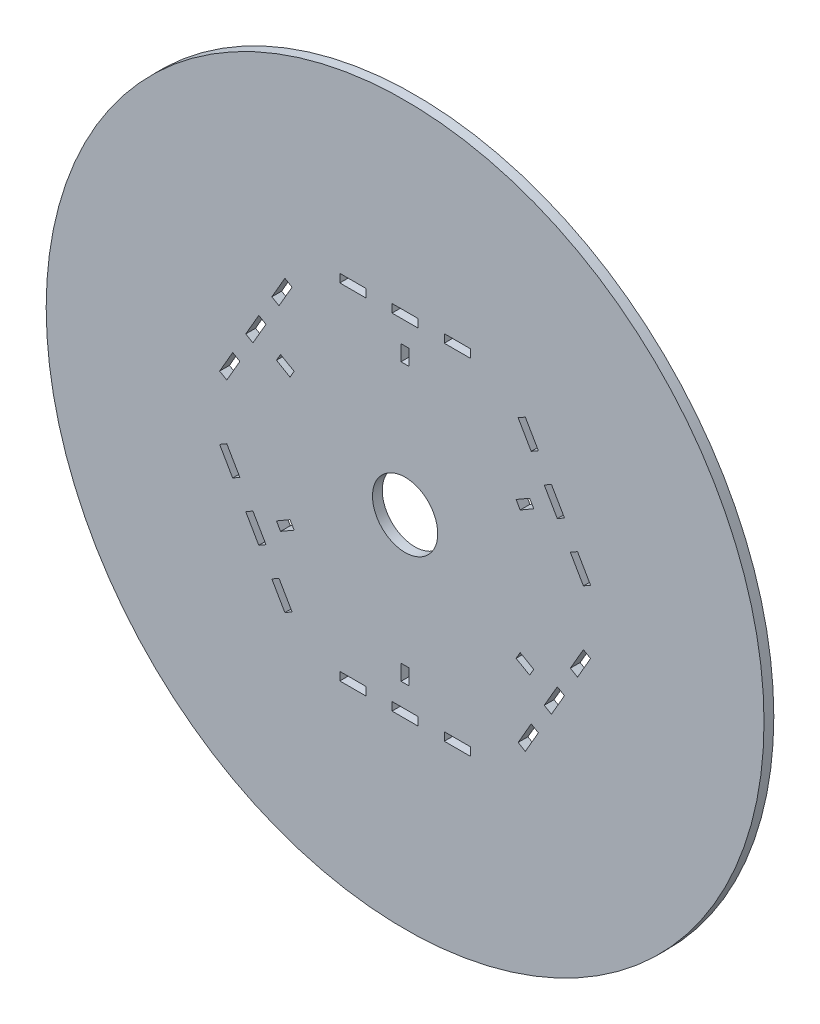
from build123d import *

# Parameters (mm, degrees)
SKETCH1_R           = 137.5
SKETCH1_R_2         = 12.5
SKETCH1_W           = 10
SKETCH1_H           = 3.175
SKETCH1_W_2         = 3.125
SKETCH1_H_2         = 6
BOSS_EXTRUDE1_DEPTH = 1.875


with BuildPart() as part:
    # Sketch1 → Boss-Extrude1 (new, symmetric)
    with BuildSketch(Plane.XY):
        Circle(SKETCH1_R)
        Circle(SKETCH1_R_2, mode=Mode.SUBTRACT)
        with Locations((0, 66.025)):
            Rectangle(SKETCH1_W, SKETCH1_H, mode=Mode.SUBTRACT)
        with Locations((-20, 66.025)):
            Rectangle(SKETCH1_W, SKETCH1_H, mode=Mode.SUBTRACT)
        with Locations((20, 66.025)):
            Rectangle(SKETCH1_W, SKETCH1_H, mode=Mode.SUBTRACT)
        with Locations((0, 53)):
            Rectangle(SKETCH1_W_2, SKETCH1_H_2, mode=Mode.SUBTRACT)
        Polygon((61.054142613, 29.476122981), (56.054142613, 38.136377019), (53.304511956, 36.548877019), (58.304511956, 27.888622981), align=None, mode=Mode.SUBTRACT)
        Polygon((51.054142613, 46.796631057), (46.054142613, 55.456885095), (43.304511956, 53.869385095), (48.304511956, 45.209131057), align=None, mode=Mode.SUBTRACT)
        Polygon((71.054142613, 12.155614905), (68.304511956, 10.568114905), (63.304511956, 19.228368943), (66.054142613, 20.815868943), align=None, mode=Mode.SUBTRACT)
        Polygon((49.278672612, 26.646835307), (47.716172612, 29.353164693), (42.520020189, 26.353164693), (44.082520189, 23.646835307), align=None, mode=Mode.SUBTRACT)
        Polygon((56.054142613, -38.136377019), (61.054142613, -29.476122981), (58.304511956, -27.888622981), (53.304511956, -36.548877019), align=None, mode=Mode.SUBTRACT)
        Polygon((66.054142613, -20.815868943), (71.054142613, -12.155614905), (68.304511956, -10.568114905), (63.304511956, -19.228368943), align=None, mode=Mode.SUBTRACT)
        Polygon((46.054142613, -55.456885095), (43.304511956, -53.869385095), (48.304511956, -45.209131057), (51.054142613, -46.796631057), align=None, mode=Mode.SUBTRACT)
        Polygon((47.716172612, -29.353164693), (49.278672612, -26.646835307), (44.082520189, -23.646835307), (42.520020189, -26.353164693), align=None, mode=Mode.SUBTRACT)
        with Locations((0, -66.025)):
            Rectangle(SKETCH1_W, SKETCH1_H, mode=Mode.SUBTRACT)
        with Locations((20, -66.025)):
            Rectangle(SKETCH1_W, SKETCH1_H, mode=Mode.SUBTRACT)
        with Locations((-20, -66.025)):
            Rectangle(SKETCH1_W, SKETCH1_H, mode=Mode.SUBTRACT)
        with Locations((0, -53)):
            Rectangle(SKETCH1_W_2, SKETCH1_H_2, mode=Mode.SUBTRACT)
        Polygon((-61.054142613, -29.476122981), (-56.054142613, -38.136377019), (-53.304511956, -36.548877019), (-58.304511956, -27.888622981), align=None, mode=Mode.SUBTRACT)
        Polygon((-51.054142613, -46.796631057), (-46.054142613, -55.456885095), (-43.304511956, -53.869385095), (-48.304511956, -45.209131057), align=None, mode=Mode.SUBTRACT)
        Polygon((-71.054142613, -12.155614905), (-68.304511956, -10.568114905), (-63.304511956, -19.228368943), (-66.054142613, -20.815868943), align=None, mode=Mode.SUBTRACT)
        Polygon((-49.278672612, -26.646835307), (-47.716172612, -29.353164693), (-42.520020189, -26.353164693), (-44.082520189, -23.646835307), align=None, mode=Mode.SUBTRACT)
        Polygon((-56.054142613, 38.136377019), (-61.054142613, 29.476122981), (-58.304511956, 27.888622981), (-53.304511956, 36.548877019), align=None, mode=Mode.SUBTRACT)
        Polygon((-66.054142613, 20.815868943), (-71.054142613, 12.155614905), (-68.304511956, 10.568114905), (-63.304511956, 19.228368943), align=None, mode=Mode.SUBTRACT)
        Polygon((-46.054142613, 55.456885095), (-43.304511956, 53.869385095), (-48.304511956, 45.209131057), (-51.054142613, 46.796631057), align=None, mode=Mode.SUBTRACT)
        Polygon((-47.716172612, 29.353164693), (-49.278672612, 26.646835307), (-44.082520189, 23.646835307), (-42.520020189, 26.353164693), align=None, mode=Mode.SUBTRACT)
    extrude(amount=BOSS_EXTRUDE1_DEPTH, both=True)


solid = part.part
